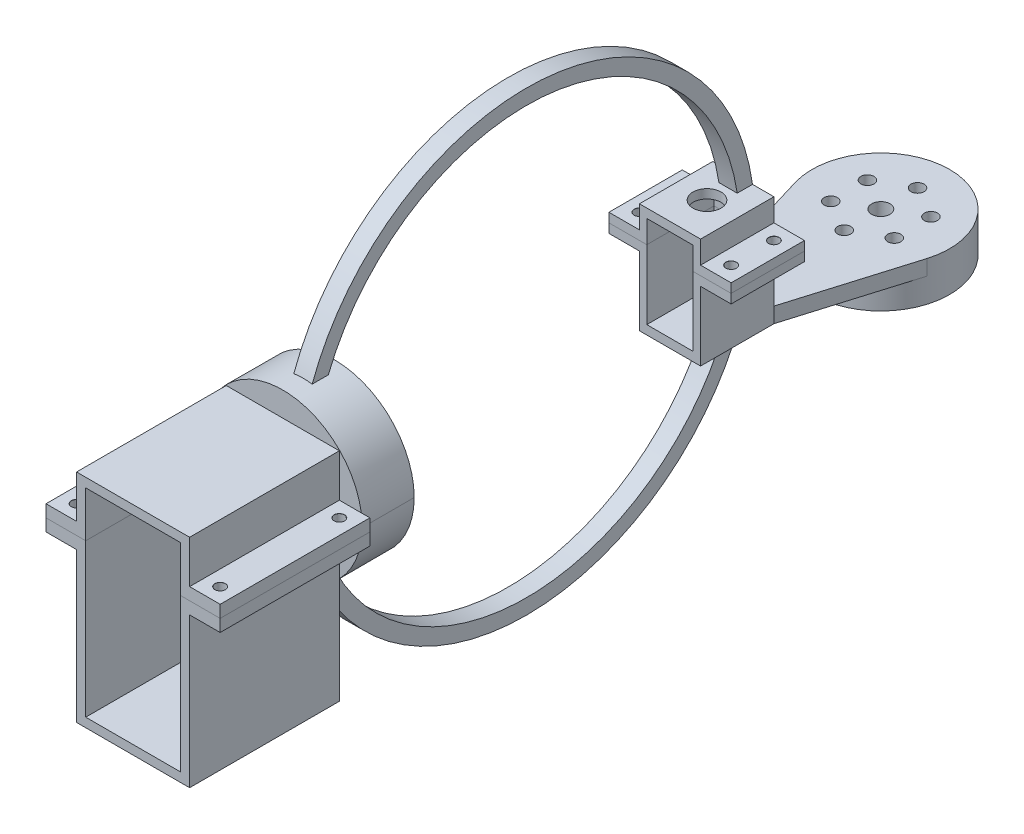
from build123d import *
from build123d.topology import SkipClean

# Parameters (mm, degrees)
SKETCH_1_W           = 20
SKETCH_1_H           = 36
EXTRUDE_1_DEPTH      = 24
SKETCH_2_W           = 15.2
SKETCH_2_H           = 30.1
CUT_EXTRUDE_1_DEPTH  = 22
CUT_EXTRUDE_2_REACH  = 46.407
SKETCH_3_R           = 4.6
EXTRUDE_2_DEPTH      = 3
EXTRUDE_2_DEPTH_BACK = 3
SKETCH_6_W           = 35
SKETCH_6_H           = 26
SKETCH_7_R           = 23
CUT_EXTRUDE_3_DEPTH  = 18
SKETCH_9_R           = 10
CUT_EXTRUDE_4_DEPTH  = 8
EXTRUDE_4_DEPTH      = 3
EXTRUDE_4_DEPTH_BACK = 3
SKETCH_12_W          = 10
SKETCH_12_H          = 24
EXTRUDE_5_DEPTH      = 5
SKETCH_16_R          = 22.5
EXTRUDE_6_DEPTH      = 8
SKETCH_17_R          = 3
SKETCH_17_R_2        = 2.15
CUT_EXTRUDE_6_DEPTH  = 13
CUT_EXTRUDE_START    = -18
SKETCH_18_R          = 26
CUT_EXTRUDE_7_DEPTH  = 18
SKETCH_20_W          = 37
SKETCH_20_H          = 71
EXTRUDE_7_DEPTH      = 49
SHELL_START          = -23.5
SHELL_1_OUTLINE_R    = 20
SHELL_1_OUTLINE_R_2  = 4.65
SHELL_1_OUTLINE_R_3  = 5.5
SHELL_1_DEPTH        = 8
SHELL_START_2        = 7.1
SHELL_1_2_DEPTH      = 1
SKETCH_21_W          = 31
SKETCH_21_H          = 65
CUT_EXTRUDE_8_DEPTH  = 46
EXTRUDE_8_DEPTH      = 4
EXTRUDE_8_DEPTH_BACK = 4
SKETCH_22_W          = 10
SKETCH_22_H          = 49


# Read off the part's stored shape, not the designer's step: M3 すきま穴1, ｼｪﾙ1, M3 すきま穴2
with BuildPart() as part:
    # ｽｹｯﾁ1 → ﾎﾞｽ - 押し出し1 (new body)
    with BuildSketch(Plane.XY):
        Rectangle(SKETCH_1_W, SKETCH_1_H)
    extrude(amount=EXTRUDE_1_DEPTH)

    # ｽｹｯﾁ2 → ｶｯﾄ - 押し出し1 (cut)
    with BuildSketch(Plane.XY.offset(24)):
        Rectangle(SKETCH_2_W, SKETCH_2_H)
    extrude(amount=-CUT_EXTRUDE_1_DEPTH, mode=Mode.SUBTRACT)

    # ｽｹｯﾁ3 → ｶｯﾄ - 押し出し2 (cut, up to next)
    with BuildSketch(Plane(origin=(0, 18, 0), x_dir=(1, 0, 0), z_dir=(0, 1, 0)), mode=Mode.PRIVATE) as cut_extrude_2_sk1:
        with Locations(Location((0, -11.9, 0), (0, 0, 270))):
            Circle(SKETCH_3_R)
    cut_extrude_2_tool1 = extrude(cut_extrude_2_sk1.sketch, amount=-CUT_EXTRUDE_2_REACH, mode=Mode.PRIVATE) & part.part
    add(cut_extrude_2_tool1.solids().sort_by_distance((0, 18, 11.9))[0], mode=Mode.SUBTRACT)

    # ｽｹｯﾁ4 → ﾎﾞｽ - 押し出し2 (add, two sides: drawn at the far end of the back side and taken through both)
    with BuildSketch(Plane.ZY.offset(-EXTRUDE_2_DEPTH_BACK)):
        with BuildLine():
            Line((0, 18), (5, 18))
            ThreePointArc((5, 18), (143.334159834, 15.469833551), (9.086211018, -18))
            Line((9.086211018, -18), (3.794587103, -18))
            ThreePointArc((3.794587103, -18), (148.315545327, 15.433244719), (0, 18))
        make_face()
    extrude(amount=EXTRUDE_2_DEPTH + EXTRUDE_2_DEPTH_BACK)

    # ｽｹｯﾁ6 → 回転1 (revolve)
    with BuildSketch(Plane.ZY, mode=Mode.PRIVATE) as revolve_1_sk:
        with Locations((151.227237337, 20.6)):
            Rectangle(SKETCH_6_W, SKETCH_6_H)
    revolve(revolve_1_sk.sketch.rotate(Axis((0, 7.6, 133.727237337), (0, 0, 1)), 90), axis=Axis((0, 7.6, 133.727237337), (0, 0, 1)))

    # ｽｹｯﾁ7 → ｶｯﾄ - 押し出し3 (cut)
    with BuildSketch(Plane.XY.offset(168.727237337)):
        with Locations((0, 7.6)):
            Circle(SKETCH_7_R)
    extrude(amount=-CUT_EXTRUDE_3_DEPTH, mode=Mode.SUBTRACT)

    # ｽｹｯﾁ9 → ｶｯﾄ - 押し出し4 (cut)
    with BuildSketch(Plane(origin=(0, 0, 133.727237337), x_dir=(-1, 0, 0), z_dir=(0, 0, -1))):
        with Locations((0, 7.6)):
            Circle(SKETCH_9_R)
    extrude(amount=-CUT_EXTRUDE_4_DEPTH, mode=Mode.SUBTRACT)

    # ｽｹｯﾁ12 → ﾎﾞｽ - 押し出し4 (add, two sides: drawn at the far end of the back side and taken through both)
    with BuildSketch(Plane(origin=(0, 7.6, 0), x_dir=(1, 0, 0), z_dir=(0, 1, 0)).offset(-EXTRUDE_4_DEPTH_BACK)):
        with Locations((-15, -12)):
            Rectangle(SKETCH_12_W, SKETCH_12_H)
        with Locations((15, -12)):
            Rectangle(SKETCH_12_W, SKETCH_12_H)
    extrude(amount=EXTRUDE_4_DEPTH + EXTRUDE_4_DEPTH_BACK)

    # M3 すきま穴1 outline → M3 すきま穴1 (revolve, cut)
    with BuildSketch(Plane(origin=(-15, 0, 5), x_dir=(1, 0, 0), z_dir=(0, 0, 1))):
        Polygon((0, 4.6), (1.7, 4.6), (1.7, 10.57124079), (1.725, 10.6), (0, 10.6), align=None)
    revolve(axis=Axis((-15, 0, 5), (0, 1, 0)), mode=Mode.SUBTRACT)

    # Hole Wizard M3 _1 2 outline → Hole Wizard M3 _1 2 (revolve, cut)
    with BuildSketch(Plane(origin=(15, 0, 19), x_dir=(1, 0, 0), z_dir=(0, 0, 1))):
        Polygon((0, 4.6), (1.7, 4.6), (1.7, 10.57124079), (1.725, 10.6), (0, 10.6), align=None)
    revolve(axis=Axis((15, 0, 19), (0, 1, 0)), mode=Mode.SUBTRACT)

    # Hole Wizard M3 _1 3 outline → Hole Wizard M3 _1 3 (revolve, cut)
    with BuildSketch(Plane(origin=(-15, 0, 19), x_dir=(1, 0, 0), z_dir=(0, 0, 1))):
        Polygon((0, 4.6), (1.7, 4.6), (1.7, 10.57124079), (1.725, 10.6), (0, 10.6), align=None)
    revolve(axis=Axis((-15, 0, 19), (0, 1, 0)), mode=Mode.SUBTRACT)

    # Hole Wizard M3 _1 4 outline → Hole Wizard M3 _1 4 (revolve, cut)
    with BuildSketch(Plane(origin=(15, 0, 5), x_dir=(1, 0, 0), z_dir=(0, 0, 1))):
        Polygon((0, 4.6), (1.7, 4.6), (1.7, 10.57124079), (1.725, 10.6), (0, 10.6), align=None)
    revolve(axis=Axis((15, 0, 5), (0, 1, 0)), mode=Mode.SUBTRACT)


with BuildPart() as body_2:
    # Split Bodies 1: the piece on the far side of the plane
    add(part.part)
    split(bisect_by=Plane.ZX.offset(7.6), keep=Keep.BOTTOM)

    # ｽｹｯﾁ15 → ﾎﾞｽ - 押し出し5 (add)
    with BuildSketch(Plane.XZ.offset(18)):
        with BuildLine():
            Line((-10, 0), (-21.552524001, -38.539449778))
            ThreePointArc((-21.552524001, -38.539449778), (0, -67.5), (21.552524001, -38.539449778))
            Line((21.552524001, -38.539449778), (10, 0))
            Line((10, 0), (-10, 0))
        make_face()
    extrude(amount=-EXTRUDE_5_DEPTH)

    # ｽｹｯﾁ16 → ﾎﾞｽ - 押し出し6 (add)
    with SkipClean():  # the faces are left unmerged after this step: merging them gives an invalid solid
        with BuildSketch(Plane.XZ.offset(18)):
            with Locations(Location((0, -45, 0), (0, 0, 270))):
                Circle(SKETCH_16_R)
        extrude(amount=EXTRUDE_6_DEPTH)

    # ｽｹｯﾁ17 → ｶｯﾄ - 押し出し6 (cut)
    with SkipClean():  # the faces are left unmerged after this step: merging them gives an invalid solid
        with BuildSketch(Plane(origin=(0, -13, 0), x_dir=(1, 0, 0), z_dir=(0, 1, 0))):
            with Locations(Location((0, 45, 0), (0, 0, 270))):
                Circle(SKETCH_17_R)
            with Locations(Location((0, 57, 0), (0, 0, 270))):
                Circle(SKETCH_17_R_2)
            with Locations(Location((10.392304845, 51, 0), (0, 0, 270))):
                Circle(SKETCH_17_R_2)
            with Locations(Location((10.392304845, 39, 0), (0, 0, 270))):
                Circle(SKETCH_17_R_2)
            with Locations(Location((0, 33, 0), (0, 0, 270))):
                Circle(SKETCH_17_R_2)
            with Locations(Location((-10.392304845, 39, 0), (0, 0, 270))):
                Circle(SKETCH_17_R_2)
            with Locations(Location((-10.392304845, 51, 0), (0, 0, 270))):
                Circle(SKETCH_17_R_2)
        extrude(amount=-CUT_EXTRUDE_6_DEPTH, mode=Mode.SUBTRACT)


with BuildPart() as part_1:
    add(part.part)

    # Split Bodies 1
    split(bisect_by=Plane.ZX.offset(7.6), keep=Keep.TOP)


with BuildPart() as cut_extrude_7_tool:
    # ｽｹｯﾁ18 → ｶｯﾄ - 押し出し7 (new body)
    with SkipClean():  # the faces are left unmerged after this step: merging them gives an invalid solid
        with BuildSketch(Plane.XY.offset(168.727237337).offset(CUT_EXTRUDE_START)):
            with Locations((0, 7.6)):
                Circle(SKETCH_18_R)
        extrude(amount=CUT_EXTRUDE_7_DEPTH)


with BuildPart() as part_2:
    with SkipClean():  # the faces are left unmerged after this step: merging them gives an invalid solid
        add(part_1.part)

        # ｶｯﾄ - 押し出し7: cut by cut_extrude_7_tool
        add(cut_extrude_7_tool.part, mode=Mode.SUBTRACT)



with BuildPart() as body_2_1:
    with SkipClean():  # the faces are left unmerged after this step: merging them gives an invalid solid
        add(body_2.part)

        # ｶｯﾄ - 押し出し7: cut by cut_extrude_7_tool
        add(cut_extrude_7_tool.part, mode=Mode.SUBTRACT)


with BuildPart() as part_3:
    with SkipClean():  # the faces are left unmerged after this step: merging them gives an invalid solid
        add(part_2.part)

        add(body_2_1.part)  # ﾎﾞｽ - 押し出し7 merges body 2
        # ｽｹｯﾁ20 → ﾎﾞｽ - 押し出し7 (add)
        with BuildSketch(Plane.XY.offset(150.727237337)):
            with Locations((0, -9.9)):
                Rectangle(SKETCH_20_W, SKETCH_20_H)
        extrude(amount=EXTRUDE_7_DEPTH)

    # ｼｪﾙ1 outline → ｼｪﾙ1 (cut)
    with SkipClean():  # the faces are left unmerged after this step: merging them gives an invalid solid
        with BuildSketch(Plane(origin=(0, 0, 0), x_dir=(1, 0, 0), z_dir=(0, 1, 0)).offset(SHELL_START)):
            with Locations((0, 45)):
                Circle(SHELL_1_OUTLINE_R)
            with Locations((-10.392304845, 39)):
                Circle(SHELL_1_OUTLINE_R_2, mode=Mode.SUBTRACT)
            with Locations((-10.392304845, 51)):
                Circle(SHELL_1_OUTLINE_R_2, mode=Mode.SUBTRACT)
            with Locations((0, 33)):
                Circle(SHELL_1_OUTLINE_R_2, mode=Mode.SUBTRACT)
            with Locations((10.392304845, 39)):
                Circle(SHELL_1_OUTLINE_R_2, mode=Mode.SUBTRACT)
            with Locations((0, 45)):
                Circle(SHELL_1_OUTLINE_R_3, mode=Mode.SUBTRACT)
            with Locations((0, 57)):
                Circle(SHELL_1_OUTLINE_R_2, mode=Mode.SUBTRACT)
            with Locations((10.392304845, 51)):
                Circle(SHELL_1_OUTLINE_R_2, mode=Mode.SUBTRACT)
        extrude(amount=SHELL_1_DEPTH, mode=Mode.SUBTRACT)

    # Shell 1 2 outline → Shell 1 2 (cut)
    with SkipClean():  # the faces are left unmerged after this step: merging them gives an invalid solid
        with BuildSketch(Plane(origin=(0, 0, 0), x_dir=(1, 0, 0), z_dir=(0, 1, 0)).offset(SHELL_START_2)):
            with BuildLine():
                ThreePointArc((11.625092594, -21.5), (12.030151519, -16.030151519), (17.5, -15.625092594))
                Line((17.5, -15.625092594), (17.5, -8.374907406))
                ThreePointArc((17.5, -8.374907406), (12.030151519, -7.969848481), (11.625092594, -2.5))
                Line((11.625092594, -2.5), (10.1, -2.5))
                Line((10.1, -2.5), (10.1, -21.5))
                Line((10.1, -21.5), (11.625092594, -21.5))
            make_face()
            with BuildLine():
                Line((-11.625092594, -21.5), (-10.1, -21.5))
                Line((-10.1, -21.5), (-10.1, -2.5))
                Line((-10.1, -2.5), (-11.625092594, -2.5))
                ThreePointArc((-11.625092594, -2.5), (-12.030151519, -7.969848481), (-17.5, -8.374907406))
                Line((-17.5, -8.374907406), (-17.5, -15.625092594))
                ThreePointArc((-17.5, -15.625092594), (-12.030151519, -16.030151519), (-11.625092594, -21.5))
            make_face()
        extrude(amount=SHELL_1_2_DEPTH, mode=Mode.SUBTRACT)

    # ｽｹｯﾁ21 → ｶｯﾄ - 押し出し8 (cut)
    with SkipClean():  # the faces are left unmerged after this step: merging them gives an invalid solid
        with BuildSketch(Plane.XY.offset(199.727237337)):
            with Locations((0, -9.9)):
                Rectangle(SKETCH_21_W, SKETCH_21_H)
        extrude(amount=-CUT_EXTRUDE_8_DEPTH, mode=Mode.SUBTRACT)

    # ｽｹｯﾁ22 → ﾎﾞｽ - 押し出し8 (add, two sides: drawn at the far end of the back side and taken through both)
    with SkipClean():  # the faces are left unmerged after this step: merging them gives an invalid solid
        with BuildSketch(Plane(origin=(0, 7.6, 0), x_dir=(1, 0, 0), z_dir=(0, 1, 0)).offset(-EXTRUDE_8_DEPTH_BACK)):
            with Locations((23.5, -175.227237337)):
                Rectangle(SKETCH_22_W, SKETCH_22_H)
            with Locations((-23.5, -175.227237337)):
                Rectangle(SKETCH_22_W, SKETCH_22_H)
        extrude(amount=EXTRUDE_8_DEPTH + EXTRUDE_8_DEPTH_BACK)

    # M3 すきま穴2 outline → M3 すきま穴2 (revolve, cut)
    with SkipClean():  # the faces are left unmerged after this step: merging them gives an invalid solid
        with BuildSketch(Plane(origin=(23.5, 0, 155.727237337), x_dir=(1, 0, 0), z_dir=(0, 0, 1))):
            Polygon((0, 3.6), (1.7, 3.6), (1.7, 11.57124079), (1.725, 11.6), (0, 11.6), align=None)
        revolve(axis=Axis((23.5, 0, 155.727237337), (0, 1, 0)), mode=Mode.SUBTRACT)

    # Hole Wizard M3 _2 2 outline → Hole Wizard M3 _2 2 (revolve, cut)
    with SkipClean():  # the faces are left unmerged after this step: merging them gives an invalid solid
        with BuildSketch(Plane(origin=(23.5, 0, 194.727237337), x_dir=(1, 0, 0), z_dir=(0, 0, 1))):
            Polygon((0, 3.6), (1.7, 3.6), (1.7, 11.57124079), (1.725, 11.6), (0, 11.6), align=None)
        revolve(axis=Axis((23.5, 0, 194.727237337), (0, 1, 0)), mode=Mode.SUBTRACT)

    # Hole Wizard M3 _2 3 outline → Hole Wizard M3 _2 3 (revolve, cut)
    with SkipClean():  # the faces are left unmerged after this step: merging them gives an invalid solid
        with BuildSketch(Plane(origin=(-23.5, 0, 155.727237337), x_dir=(1, 0, 0), z_dir=(0, 0, 1))):
            Polygon((0, 3.6), (1.7, 3.6), (1.7, 11.57124079), (1.725, 11.6), (0, 11.6), align=None)
        revolve(axis=Axis((-23.5, 0, 155.727237337), (0, 1, 0)), mode=Mode.SUBTRACT)

    # Hole Wizard M3 _2 4 outline → Hole Wizard M3 _2 4 (revolve, cut)
    with SkipClean():  # the faces are left unmerged after this step: merging them gives an invalid solid
        with BuildSketch(Plane(origin=(-23.5, 0, 194.727237337), x_dir=(1, 0, 0), z_dir=(0, 0, 1))):
            Polygon((0, 3.6), (1.7, 3.6), (1.7, 11.57124079), (1.725, 11.6), (0, 11.6), align=None)
        revolve(axis=Axis((-23.5, 0, 194.727237337), (0, 1, 0)), mode=Mode.SUBTRACT)


with BuildPart() as body_2_2:
    # Split Bodies 2: the piece on the far side of the plane
    add(part_3.part)
    split(bisect_by=Plane.ZX.offset(7.6), keep=Keep.BOTTOM)


with BuildPart() as part_4:
    add(part_3.part)

    # Split Bodies 2
    split(bisect_by=Plane.ZX.offset(7.6), keep=Keep.TOP)


solid = Compound([body_2_2.part, part_4.part])
